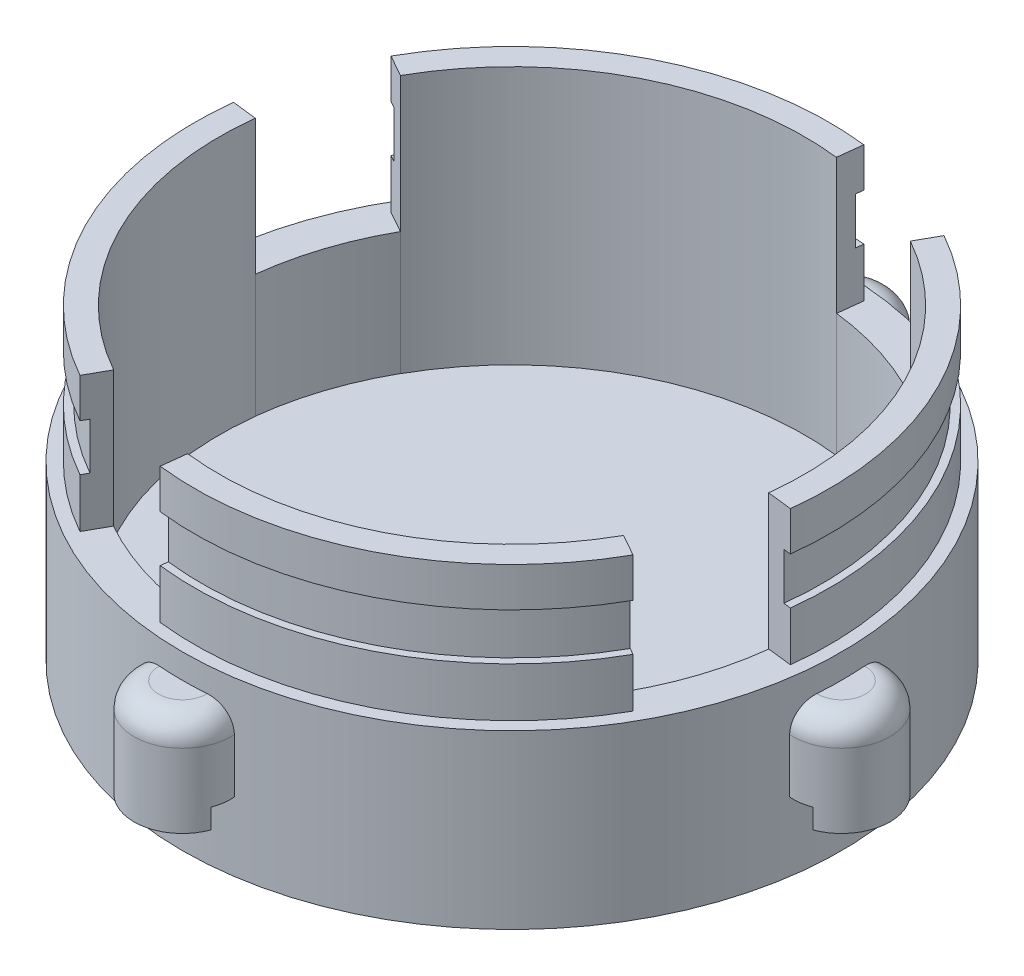
from build123d import *

# Parameters (mm, degrees)
SKETCH3_R             = 34.036
SKETCH3_R_2           = 30.226
BOSS_EXTRUDE2_DEPTH   = 12.7
BOSS_EXTRUDE6_DEPTH   = 26.67
BOSS_EXTRUDE6_2_DEPTH = 26.67
BOSS_EXTRUDE6_3_DEPTH = 26.67
BOSS_EXTRUDE6_4_DEPTH = 26.67
CUT_EXTRUDE2_START    = 17.78
SKETCH7_R             = 34.036
SKETCH7_R_2           = 32.004
CUT_EXTRUDE2_DEPTH    = 4.826
BOSS_EXTRUDE7_START   = -5.08
SKETCH8_R             = 34.036
SKETCH8_R_2           = 5
BOSS_EXTRUDE7_DEPTH   = 5.08
BOSS_EXTRUDE8_DEPTH   = 10.16
FILLET1_R             = 2.54
SKETCH11_R            = 36.068
SKETCH11_R_2          = 34.036
CUT_EXTRUDE3_DEPTH    = 2.032


with BuildPart() as part:
    # Sketch3 → Boss-Extrude2 (new body)
    with BuildSketch(Plane(origin=(0, 0, 0), x_dir=(1, 0, 0), z_dir=(0, 1, 0))):
        Circle(SKETCH3_R)
        Circle(SKETCH3_R_2, mode=Mode.SUBTRACT)
    extrude(amount=BOSS_EXTRUDE2_DEPTH)



with BuildPart() as body_2:
    # Sketch5 → Boss-Extrude6 (new body)
    with BuildSketch(Plane(origin=(0, 0, 0), x_dir=(1, 0, 0), z_dir=(0, 1, 0))):
        with BuildLine():
            ThreePointArc((-3.792010539, -32.545835557), (14.875452714, -29.194719772), (28.559021933, -16.062161195))
            Line((28.559021933, -16.062161195), (26.330368575, -14.80872228))
            ThreePointArc((26.330368575, -14.80872228), (13.713740726, -26.916906957), (-3.498056233, -30.005835557))
            Line((-3.498056233, -30.005835557), (-3.792010539, -32.545835557))
        make_face()
    extrude(amount=BOSS_EXTRUDE6_DEPTH)


with BuildPart() as body_3:
    # Sketch5 → Boss-Extrude6 2 (new body)
    with BuildSketch(Plane(origin=(0, 0, 0), x_dir=(1, 0, 0), z_dir=(0, 1, 0))):
        with BuildLine():
            ThreePointArc((-32.545835557, 3.792010539), (-29.194719772, -14.875452714), (-16.062161195, -28.559021933))
            Line((-16.062161195, -28.559021933), (-14.80872228, -26.330368575))
            ThreePointArc((-14.80872228, -26.330368575), (-26.916906957, -13.713740726), (-30.005835557, 3.498056233))
            Line((-30.005835557, 3.498056233), (-32.545835557, 3.792010539))
        make_face()
    extrude(amount=BOSS_EXTRUDE6_2_DEPTH)


with BuildPart() as body_4:
    # Sketch5 → Boss-Extrude6 3 (new body)
    with BuildSketch(Plane(origin=(0, 0, 0), x_dir=(1, 0, 0), z_dir=(0, 1, 0))):
        with BuildLine():
            ThreePointArc((3.792010539, 32.545835557), (-14.875452714, 29.194719772), (-28.559021933, 16.062161195))
            Line((-28.559021933, 16.062161195), (-26.330368575, 14.80872228))
            ThreePointArc((-26.330368575, 14.80872228), (-13.713740726, 26.916906957), (3.498056233, 30.005835557))
            Line((3.498056233, 30.005835557), (3.792010539, 32.545835557))
        make_face()
    extrude(amount=BOSS_EXTRUDE6_3_DEPTH)


with BuildPart() as body_5:
    # Sketch5 → Boss-Extrude6 4 (new body)
    with BuildSketch(Plane(origin=(0, 0, 0), x_dir=(1, 0, 0), z_dir=(0, 1, 0))):
        with BuildLine():
            ThreePointArc((14.80872228, 26.330368575), (26.916906957, 13.713740726), (30.005835557, -3.498056233))
            Line((30.005835557, -3.498056233), (32.545835557, -3.792010539))
            ThreePointArc((32.545835557, -3.792010539), (29.194719772, 14.875452714), (16.062161195, 28.559021933))
            Line((16.062161195, 28.559021933), (14.80872228, 26.330368575))
        make_face()
    extrude(amount=BOSS_EXTRUDE6_4_DEPTH)


with BuildPart() as cut_extrude2_tool:
    # Sketch7 → Cut-Extrude2 (new body)
    with BuildSketch(Plane(origin=(0, 0, 0), x_dir=(1, 0, 0), z_dir=(0, 1, 0)).offset(CUT_EXTRUDE2_START)):
        Circle(SKETCH7_R)
        Circle(SKETCH7_R_2, mode=Mode.SUBTRACT)
    extrude(amount=CUT_EXTRUDE2_DEPTH)


with BuildPart() as body_2_1:
    add(body_2.part)

    # Cut-Extrude2: cut by cut_extrude2_tool
    add(cut_extrude2_tool.part, mode=Mode.SUBTRACT)


with BuildPart() as body_3_1:
    add(body_3.part)

    # Cut-Extrude2: cut by cut_extrude2_tool
    add(cut_extrude2_tool.part, mode=Mode.SUBTRACT)


with BuildPart() as body_4_1:
    add(body_4.part)

    # Cut-Extrude2: cut by cut_extrude2_tool
    add(cut_extrude2_tool.part, mode=Mode.SUBTRACT)


with BuildPart() as body_5_1:
    add(body_5.part)

    # Cut-Extrude2: cut by cut_extrude2_tool
    add(cut_extrude2_tool.part, mode=Mode.SUBTRACT)


with BuildPart() as part_1:
    add(part.part)

    add(body_2_1.part)  # Boss-Extrude7 merges body 2

    add(body_3_1.part)  # Boss-Extrude7 merges body 3

    add(body_4_1.part)  # Boss-Extrude7 merges body 4

    add(body_5_1.part)  # Boss-Extrude7 merges body 5
    # Sketch8 → Boss-Extrude7 (add)
    with BuildSketch(Plane(origin=(0, 0, 0), x_dir=(1, 0, 0), z_dir=(0, 1, 0)).offset(BOSS_EXTRUDE7_START)):
        Circle(SKETCH8_R)
        Circle(SKETCH8_R_2, mode=Mode.SUBTRACT)
    extrude(amount=BOSS_EXTRUDE7_DEPTH)

    # Sketch10 → Boss-Extrude8 (add)
    with BuildSketch(Plane(origin=(0, 0, 0), x_dir=(1, 0, 0), z_dir=(0, 1, 0))):
        with BuildLine():
            ThreePointArc((33.667981618, 4.991623958), (34.036, 0), (33.667981618, -4.991623958))
            ThreePointArc((33.667981618, -4.991623958), (39.041172052, 0), (33.667981618, 4.991623958))
        make_face()
        with BuildLine():
            ThreePointArc((-4.991623958, 33.667981618), (0, 34.036), (4.991623958, 33.667981618))
            ThreePointArc((4.991623958, 33.667981618), (0, 39.041172052), (-4.991623958, 33.667981618))
        make_face()
        with BuildLine():
            ThreePointArc((-4.991623958, -33.667981618), (0, -39.041172052), (4.991623958, -33.667981618))
            ThreePointArc((4.991623958, -33.667981618), (0, -34.036), (-4.991623958, -33.667981618))
        make_face()
        with BuildLine():
            ThreePointArc((-33.667981618, -4.991623958), (-34.036, 0), (-33.667981618, 4.991623958))
            ThreePointArc((-33.667981618, 4.991623958), (-39.041172052, 0), (-33.667981618, -4.991623958))
        make_face()
    extrude(amount=BOSS_EXTRUDE8_DEPTH)

    # Fillet1
    fillet1_edges = [part_1.edges().sort_by_distance(p)[0] for p in [
        (39.041172052, 10.16, 0),
        (0, 10.16, -39.041172052),
        (-39.041172052, 10.16, 0),
        (0, 10.16, 39.041172052),
    ]]
    fillet(fillet1_edges, radius=FILLET1_R)

    # Sketch11 → Cut-Extrude3 (cut)
    with BuildSketch(Plane(origin=(0, 0, 0), x_dir=(1, 0, 0), z_dir=(0, 1, 0))):
        Circle(SKETCH11_R)
        Circle(SKETCH11_R_2, mode=Mode.SUBTRACT)
    extrude(amount=CUT_EXTRUDE3_DEPTH, mode=Mode.SUBTRACT)


solid = part_1.part
